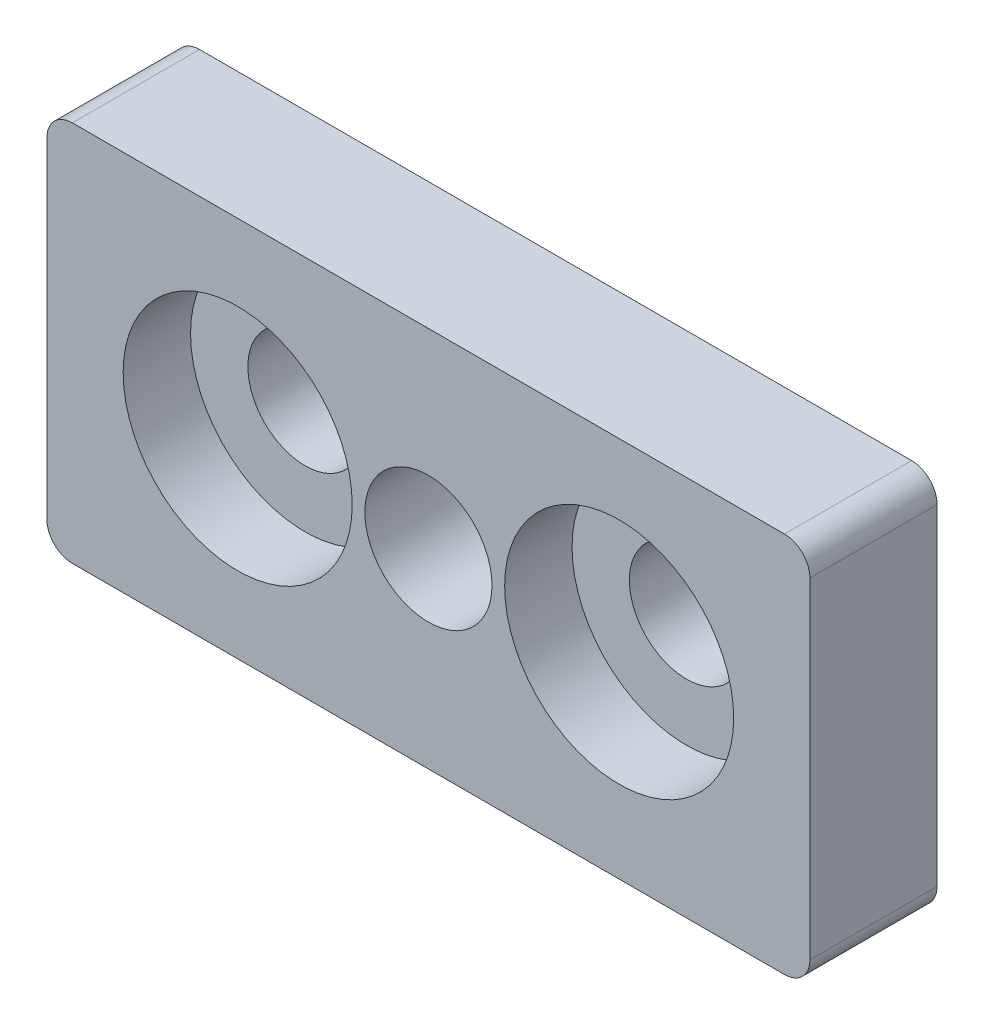
from build123d import *

# Parameters (mm, degrees)
SKETCH1_W                               = 60
SKETCH1_H                               = 30
BOSS_EXTRUDE1_DEPTH                     = 10
F_10_0_10_DIAMETER_HOLE1_D              = 10
CBORE_FOR_M8_HEX_HEAD_BOLT1_D           = 9
CBORE_FOR_M8_HEX_HEAD_BOLT1_CBORE_D     = 18.011
CBORE_FOR_M8_HEX_HEAD_BOLT1_CBORE_DEPTH = 5.3
FILLET1_R                               = 2


with BuildPart() as part:
    # Sketch1 → Boss-Extrude1 (new body)
    with BuildSketch(Plane.XY.offset(10)):
        Rectangle(SKETCH1_W, SKETCH1_H)
    extrude(amount=-BOSS_EXTRUDE1_DEPTH)

    # Ø10.0 (10) Diameter Hole1 (through all)
    with Locations(Plane.XY.offset(10)):
        with Locations((0, 0)):
            Hole(F_10_0_10_DIAMETER_HOLE1_D / 2)

    # CBORE for M8 Hex Head Bolt1 (through all)
    with Locations(Plane.XY.offset(10)):
        with Locations((-15, 0), (15, 0.462807071)):
            CounterBoreHole(CBORE_FOR_M8_HEX_HEAD_BOLT1_D / 2, CBORE_FOR_M8_HEX_HEAD_BOLT1_CBORE_D / 2, CBORE_FOR_M8_HEX_HEAD_BOLT1_CBORE_DEPTH)

    # Fillet1
    fillet1_edges = [part.edges().sort_by_distance(p)[0] for p in [
        (-30, -15, 5),
        (-30, 15, 5),
        (30, -15, 5),
        (30, 15, 5),
    ]]
    fillet(fillet1_edges, radius=FILLET1_R)


solid = part.part
